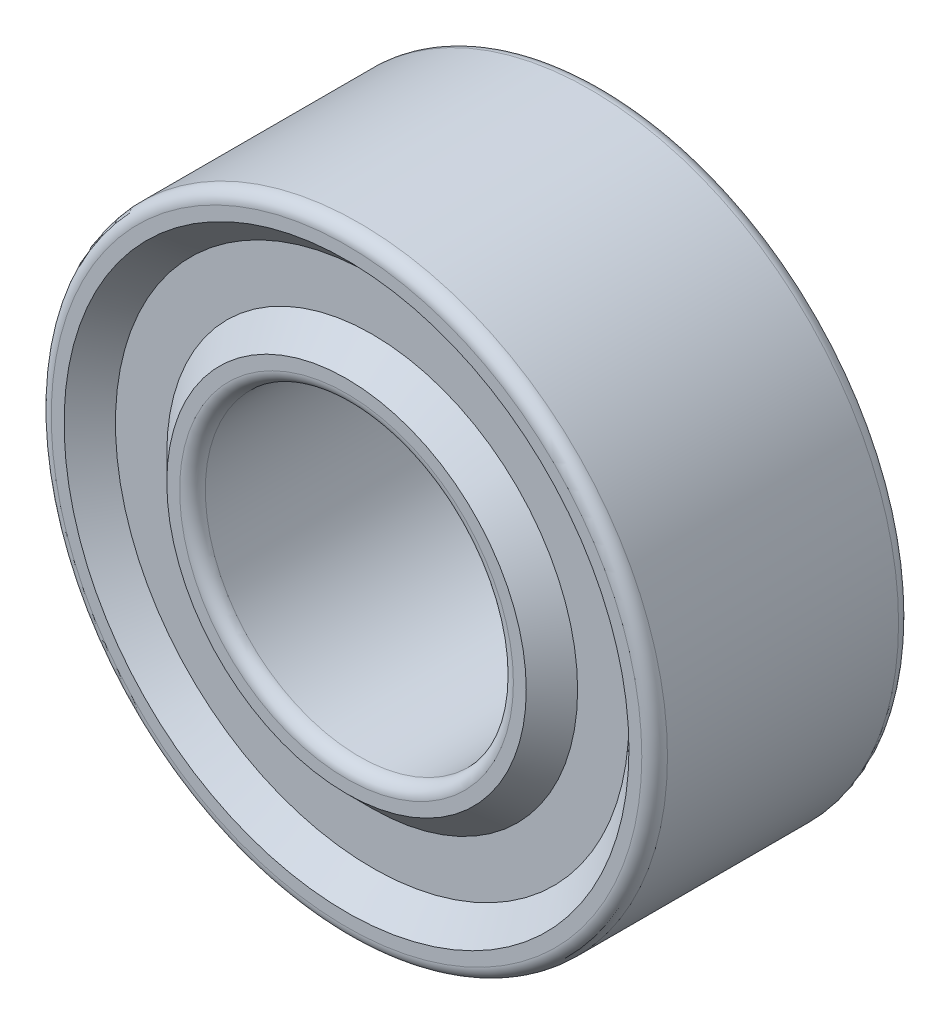
from build123d import *

# Parameters (mm, degrees)
SKETCH1_R           = 3
SKETCH1_R_2         = 1.5
BOSS_EXTRUDE1_DEPTH = 2.5
SKETCH2_R           = 2.75
SKETCH2_R_2         = 1.75
CUT_EXTRUDE1_DEPTH  = 0.25
CUT_EXTRUDE2_START  = -2.25
SKETCH2_2_R         = 2.75
SKETCH2_2_R_2       = 1.75
CUT_EXTRUDE2_DEPTH  = 0.25
FILLET1_R           = 0.125
CHAMFER1_SIZE       = 0.25


with BuildPart() as part:
    # Sketch1 → Boss-Extrude1 (new body)
    with BuildSketch(Plane.XY):
        Circle(SKETCH1_R)
        Circle(SKETCH1_R_2, mode=Mode.SUBTRACT)
    extrude(amount=BOSS_EXTRUDE1_DEPTH)

    # Sketch2 → Cut-Extrude1 (cut)
    with BuildSketch(Plane.XY.offset(2.5)):
        Circle(SKETCH2_R)
        Circle(SKETCH2_R_2, mode=Mode.SUBTRACT)
    extrude(amount=-CUT_EXTRUDE1_DEPTH, mode=Mode.SUBTRACT)

    # Sketch2<2> → Cut-Extrude2 (cut)
    with BuildSketch(Plane.XY.offset(2.5).offset(CUT_EXTRUDE2_START)):
        Circle(SKETCH2_2_R)
        Circle(SKETCH2_2_R_2, mode=Mode.SUBTRACT)
    extrude(amount=-CUT_EXTRUDE2_DEPTH, mode=Mode.SUBTRACT)

    # Fillet1
    fillet1_edges = [part.edges().sort_by_distance(p)[0] for p in [
        (-3, 0, 0),
        (-3, 0, 2.5),
        (-1.5, 0, 0),
        (-1.5, 0, 2.5),
    ]]
    fillet(fillet1_edges, radius=FILLET1_R)

    # Chamfer1
    chamfer1_edges = [part.edges().sort_by_distance(p)[0] for p in [
        (-2.75, 0, 2.25),
        (-1.75, 0, 2.25),
        (-2.75, 0, 0.25),
        (-1.75, 0, 0.25),
    ]]
    chamfer(chamfer1_edges, length=CHAMFER1_SIZE - 0.0001)  # a hair under: the kernel refuses the full size


solid = part.part
